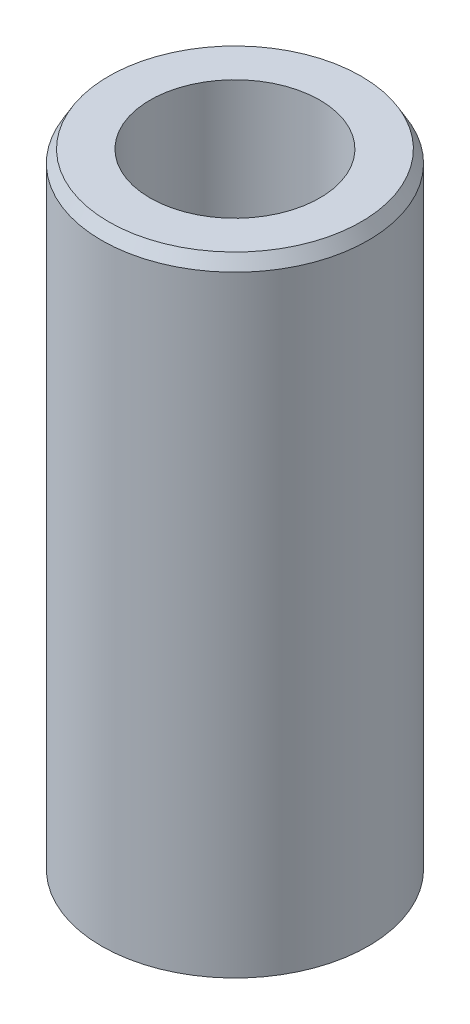
from build123d import *
from OCP.BRepFilletAPI import BRepFilletAPI_MakeChamfer

# Parameters (mm, degrees)
SKETCH1_R           = 30
BOSS_EXTRUDE1_DEPTH = 141.901696832
SKETCH2_R           = 19.089272041
CUT_EXTRUDE1_DEPTH  = 149.108377763
CHAMFER1_SIZE       = 2.79629081
CHAMFER1_SIZE2      = 1.614439252


with BuildPart() as part:
    # Sketch1 → Boss-Extrude1 (new body)
    with BuildSketch(Plane(origin=(0, 0, 0), x_dir=(1, 0, 0), z_dir=(0, 1, 0))):
        Circle(SKETCH1_R)
    extrude(amount=BOSS_EXTRUDE1_DEPTH)

    # Sketch2 → Cut-Extrude1 (cut, through all)
    with BuildSketch(Plane(origin=(0, 0, 0), x_dir=(1, 0, 0), z_dir=(0, 1, 0))):
        Circle(SKETCH2_R)
    extrude(amount=CUT_EXTRUDE1_DEPTH, mode=Mode.SUBTRACT)

    # Chamfer1: one chamfer whose edges measure the first distance from different faces: ONE call of the kernel's chamfer builder (chamfer() names one face for all edges)
    chamfer1_edges_1 = [part.edges().sort_by_distance(p)[0] for p in [
        (-30, 141.901696832, 0),
    ]]
    chamfer1_side_1 = [part.faces().sort_by_distance(p)[0] for p in [
        (-30, 70.950848416, 0),
    ]]
    chamfer1_edges_2 = [part.edges().sort_by_distance(p)[0] for p in [
        (-30, 0, 0),
    ]]
    chamfer1_side_2 = [part.faces().sort_by_distance(p)[0] for p in [
        (-29.151471863, 0, 0),
    ]]
    chamfer1 = BRepFilletAPI_MakeChamfer(part.part.solid().wrapped)
    for e in chamfer1_edges_1:
        chamfer1.Add(CHAMFER1_SIZE, CHAMFER1_SIZE2, e.wrapped, chamfer1_side_1[0].wrapped)  # the first distance lies on this face
    for e in chamfer1_edges_2:
        chamfer1.Add(CHAMFER1_SIZE, CHAMFER1_SIZE2, e.wrapped, chamfer1_side_2[0].wrapped)  # the first distance lies on this face
    add(Compound.cast(chamfer1.Shape()), mode=Mode.REPLACE)


solid = part.part
